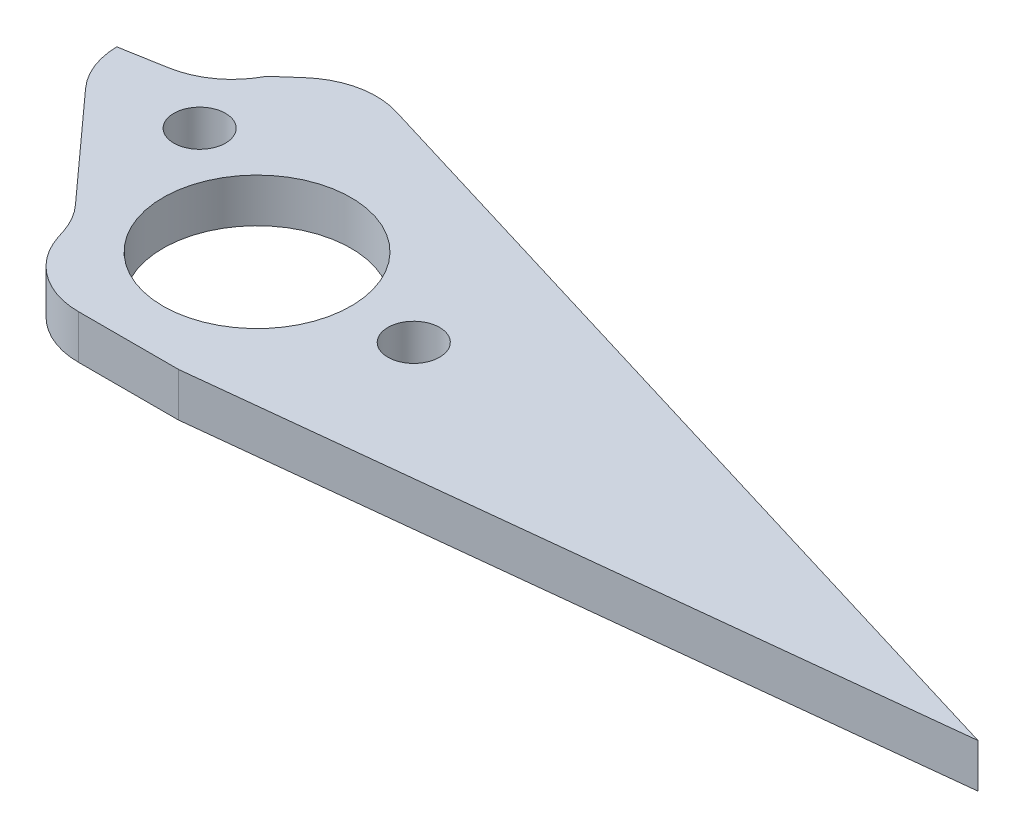
from build123d import *

# Parameters (mm, degrees)
SKETCH1_R           = 6
BOSS_EXTRUDE3_DEPTH = 2.8
FILLET1_R           = 5
SKETCH5_R           = 1.65
CUT_EXTRUDE2_DEPTH  = 10
CHAMFER1_SIZE       = 6.5
CHAMFER1_SIZE_2     = 1.146125375
FILLET2_R           = 5


with BuildPart() as part:
    # Sketch1 → Boss-Extrude3 (new body)
    with BuildSketch(Plane(origin=(0, 0, 0), x_dir=(1, 0, 0), z_dir=(0, 1, 0))):
        Polygon((-9.4, 10), (-6, 13), (50, -4), (4, -9), (-6, -9), (-7.660869565, -4), (-15.8, 5), (-15.8, 8), (-9.4, 8), align=None)
        with Locations(Location((0, 0, 0), (0, 0, 270))):
            Circle(SKETCH1_R, mode=Mode.SUBTRACT)
    extrude(amount=BOSS_EXTRUDE3_DEPTH)

    # Fillet1
    fillet1_edges = [part.edges().sort_by_distance(p)[0] for p in [
        (-6, 1.4, -13),
        (-6, 1.4, 9),
        (-7.660869565, 1.4, 4),
        (-15.8, 1.4, -5),
    ]]
    fillet(fillet1_edges, radius=FILLET1_R)

    # Sketch5 → Cut-Extrude2 (cut)
    with BuildSketch(Plane.XZ):
        with Locations(Location((10, 0, 0), (0, 0, 270))):
            Circle(SKETCH5_R)
        with Locations(Location((-8.660254038, -5, 0), (0, 0, 270))):
            Circle(SKETCH5_R)
    extrude(amount=-CUT_EXTRUDE2_DEPTH, mode=Mode.SUBTRACT)

    # Chamfer1
    # the kernel refuses this chamfer: 6.5, 1.146125375 mm, written as the material it takes off along each edge
    with BuildSketch(Plane(origin=(-15.8, -16.890502177, -8), x_dir=(0.9999776716360547, 0, -0.006682531656101837), z_dir=(0, 1, 0))) as chamfer1_piece_1_section:
        Polygon((CHAMFER1_SIZE * 0.999977671636, -CHAMFER1_SIZE * 0.0066825316561), (-CHAMFER1_SIZE_2 * 0.0066825316538, -CHAMFER1_SIZE_2 * 0.999977671291), (0, 0), align=None)
    chamfer1_piece_1 = extrude(amount=36.581004353, mode=Mode.PRIVATE)
    chamfer1_piece_1 = split(chamfer1_piece_1, bisect_by=Plane(origin=(-9.4, 1.4, -7.685869002), z_dir=(-1, 0, 0)), keep=Keep.TOP, mode=Mode.PRIVATE)
    add(chamfer1_piece_1, mode=Mode.SUBTRACT)

    # Fillet2
    # the kernel refuses this fillet: 5 mm, written as the material it adds along each edge
    with BuildSketch(Plane(origin=(-9.4, 2.8, -7.982367302), x_dir=(-0.984807753012237, 0, 0.1736481776667665), z_dir=(0, -1, 0))) as fillet2_piece_1:
        with BuildLine():
            CenterArc((3.639843813, 5), FILLET2_R, 217.056619291, 52.943380709)
            Line((-0.350358241, 1.986980324), (-0.430162282, 1.92671993))
            ThreePointArc((-0.430162282, 1.92671993), (-0.273659896, 0.976125344), (-0.098480775, -0.017364818))
            Line((-0.098480775, -0.017364818), (0, -0.1))
            Line((0, -0.1), (3.639843813, -0.1))
            Line((3.639843813, -0.1), (3.639843813, 0))
        make_face()
    extrude(amount=2.8)


solid = part.part
